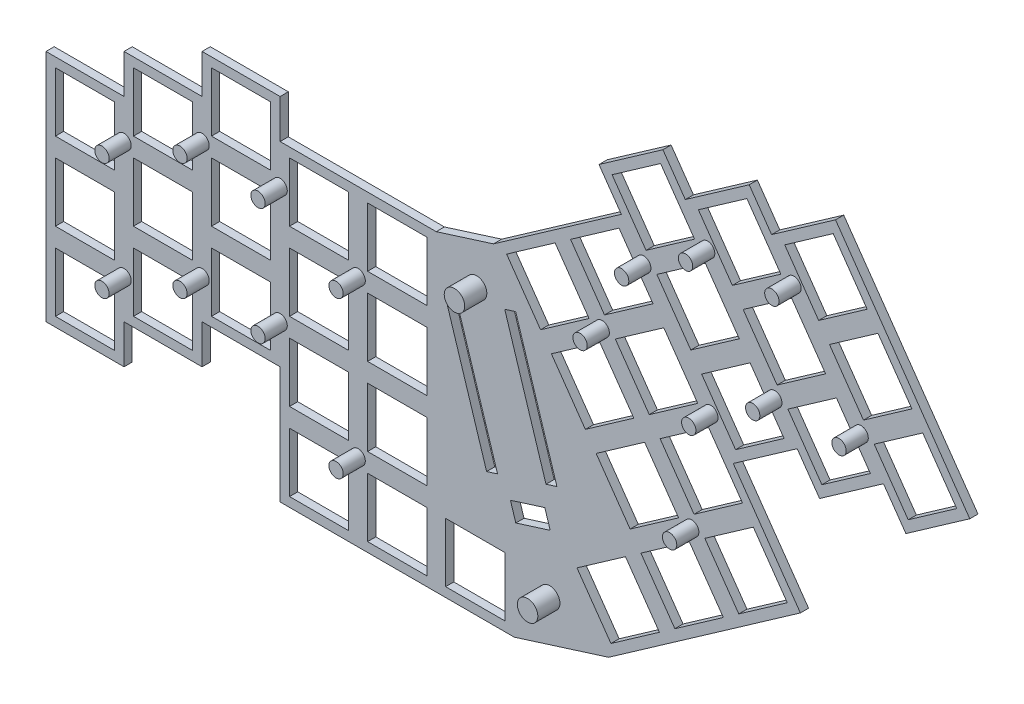
from build123d import *

# Parameters (mm, degrees)
SKETCH8_W               = 14.45
SKETCH8_H               = 14.45
SKETCH8_W_2             = 19.05
SKETCH8_H_2             = 19.05
BOSS_EXTRUDE3_DEPTH     = 2
BOSS_EXTRUDE5_DEPTH     = 2
CUT_EXTRUDE1_DEPTH      = 236.163517616
CUT_EXTRUDE1_DEPTH_BACK = 236.163517616
SKETCH17_R              = 1.75
SKETCH17_R_2            = 2.5
BOSS_EXTRUDE6_DEPTH     = 5.4


with BuildPart() as part:
    # Sketch8 → Boss-Extrude3 (new body)
    # profile 1 of 18: a face of its own
    with BuildSketch(Plane.XY):
        Polygon((19.05, 0), (0, 0), (0, -19.05), (19.05, -19.05), (19.05, -9.525), align=None)
        with Locations((9.525, -9.525)):
            Rectangle(SKETCH8_W, SKETCH8_H, mode=Mode.SUBTRACT)
    # profile 2 of 18: a face of its own
    with BuildSketch(Plane.XY):
        Polygon((19.05, 9.525), (19.05, 0), (19.05, -9.525), (38.1, -9.525), (38.1, 0), (38.1, 9.525), align=None)
        with Locations((28.575, 0)):
            Rectangle(SKETCH8_W, SKETCH8_H, mode=Mode.SUBTRACT)
    # profile 3 of 18: a face of its own
    with BuildSketch(Plane.XY):
        Polygon((19.05, -19.05), (0, -19.05), (0, -38.1), (19.05, -38.1), (19.05, -28.575), align=None)
        with Locations((9.525, -28.575)):
            Rectangle(SKETCH8_W, SKETCH8_H, mode=Mode.SUBTRACT)
    # profile 4 of 18: a face of its own
    with BuildSketch(Plane.XY):
        Polygon((38.1, -9.525), (19.05, -9.525), (19.05, -19.05), (19.05, -28.575), (38.1, -28.575), (38.1, -19.05), align=None)
        with Locations((28.575, -19.05)):
            Rectangle(SKETCH8_W, SKETCH8_H, mode=Mode.SUBTRACT)
    # profile 5 of 18: a face of its own
    with BuildSketch(Plane.XY):
        Polygon((19.05, -38.1), (0, -38.1), (0, -57.15), (19.05, -57.15), (19.05, -47.625), align=None)
        with Locations((9.525, -47.625)):
            Rectangle(SKETCH8_W, SKETCH8_H, mode=Mode.SUBTRACT)
    # profile 6 of 18: a face of its own
    with BuildSketch(Plane.XY):
        Polygon((38.1, 0), (38.1, -9.525), (38.1, -19.05), (57.15, -19.05), (57.15, -9.525), (57.15, 0), align=None)
        with Locations((47.625, -9.525)):
            Rectangle(SKETCH8_W, SKETCH8_H, mode=Mode.SUBTRACT)
    # profile 7 of 18: a face of its own
    with BuildSketch(Plane.XY):
        Polygon((38.1, 19.05), (38.1, 9.525), (38.1, 0), (57.15, 0), (57.15, 9.525), (57.15, 19.05), align=None)
        with Locations((47.625, 9.525)):
            Rectangle(SKETCH8_W, SKETCH8_H, mode=Mode.SUBTRACT)
    # profile 8 of 18: a face of its own
    with BuildSketch(Plane.XY):
        Polygon((38.1, -28.575), (19.05, -28.575), (19.05, -38.1), (19.05, -47.625), (38.1, -47.625), (38.1, -38.1), align=None)
        with Locations((28.575, -38.1)):
            Rectangle(SKETCH8_W, SKETCH8_H, mode=Mode.SUBTRACT)
    # profile 9 of 18: a face of its own
    with BuildSketch(Plane.XY):
        Polygon((57.15, -19.05), (38.1, -19.05), (38.1, -28.575), (38.1, -38.1), (57.15, -38.1), (57.15, -28.575), align=None)
        with Locations((47.625, -28.575)):
            Rectangle(SKETCH8_W, SKETCH8_H, mode=Mode.SUBTRACT)
    # profile 10 of 18: a face of its own
    with BuildSketch(Plane.XY):
        Polygon((57.15, 9.525), (57.15, 0), (57.15, -9.525), (76.2, -9.525), (76.2, 9.525), align=None)
        with Locations((66.675, 0)):
            Rectangle(SKETCH8_W, SKETCH8_H, mode=Mode.SUBTRACT)
    # profile 11 of 18: a face of its own
    with BuildSketch(Plane.XY):
        Polygon((57.15, -9.525), (57.15, -19.05), (57.15, -28.575), (76.2, -28.575), (76.2, -9.525), align=None)
        with Locations((66.675, -19.05)):
            Rectangle(SKETCH8_W, SKETCH8_H, mode=Mode.SUBTRACT)
    # profile 12 of 18: a face of its own
    with BuildSketch(Plane.XY):
        Polygon((76.2, -28.575), (57.15, -28.575), (57.15, -38.1), (57.15, -47.625), (76.2, -47.625), align=None)
        with Locations((66.675, -38.1)):
            Rectangle(SKETCH8_W, SKETCH8_H, mode=Mode.SUBTRACT)
    # profile 13 of 18: a face of its own
    with BuildSketch(Plane.XY):
        with Locations((85.725, 0)):
            Rectangle(SKETCH8_W_2, SKETCH8_H_2)
        with Locations((85.725, 0)):
            Rectangle(SKETCH8_W, SKETCH8_H, mode=Mode.SUBTRACT)
    # profile 14 of 18: a face of its own
    with BuildSketch(Plane.XY):
        with Locations((85.725, -19.05)):
            Rectangle(SKETCH8_W_2, SKETCH8_H_2)
        with Locations((85.725, -19.05)):
            Rectangle(SKETCH8_W, SKETCH8_H, mode=Mode.SUBTRACT)
    # profile 15 of 18: a face of its own
    with BuildSketch(Plane.XY):
        with Locations((85.725, -38.1)):
            Rectangle(SKETCH8_W_2, SKETCH8_H_2)
        with Locations((85.725, -38.1)):
            Rectangle(SKETCH8_W, SKETCH8_H, mode=Mode.SUBTRACT)
    # profile 16 of 18: a face of its own
    with BuildSketch(Plane.XY):
        with Locations((66.675, -57.15)):
            Rectangle(SKETCH8_W_2, SKETCH8_H_2)
        with Locations((66.675, -57.15)):
            Rectangle(SKETCH8_W, SKETCH8_H, mode=Mode.SUBTRACT)
    # profile 17 of 18: a face of its own
    with BuildSketch(Plane.XY):
        with Locations((85.725, -57.15)):
            Rectangle(SKETCH8_W_2, SKETCH8_H_2)
        with Locations((85.725, -57.15)):
            Rectangle(SKETCH8_W, SKETCH8_H, mode=Mode.SUBTRACT)
    # profile 18 of 18: a face of its own
    with BuildSketch(Plane.XY):
        with Locations((104.775, -57.15)):
            Rectangle(SKETCH8_W_2, SKETCH8_H_2)
        with Locations((104.775, -57.15)):
            Rectangle(SKETCH8_W, SKETCH8_H, mode=Mode.SUBTRACT)
    extrude(amount=BOSS_EXTRUDE3_DEPTH)

    # Sketch9 → Boss-Extrude5 (add)
    with BuildSketch(Plane.XY):
        Polygon((114.3, -47.625), (114.3, -66.675), (125.819418193, -63.042941395), (102.24357919, 11.730067049), (95.25, 9.525), (95.25, -47.625), align=None)
    extrude(amount=BOSS_EXTRUDE5_DEPTH)

    # Mirror4: part across plane


with BuildPart() as part_1:
    add(part.part)
    add(part.part.mirror(Plane(origin=(96.362353078, 30.382933219, 0), x_dir=(0, 0, 1), z_dir=(0.9537169507482277, 0.3007057995042709, 0))))

    # Sketch11 → Cut-Extrude1 (cut, two sides: drawn at the far end of the back side and taken through both)
    with BuildSketch(Plane.XY.offset(2).offset(-CUT_EXTRUDE1_DEPTH_BACK)):
        Polygon((121.764653081, -35.550627536), (123.072723309, -39.699296272), (114.680014142, -42.345507307), (113.371943914, -38.196838572), align=None)
        Polygon((111.975587939, 1.482237731), (114.645995401, 2.32421397), (124.719639684, -29.62530388), (122.049232222, -30.467280119), align=None)
        Polygon((110.223142033, -34.196032033), (107.552734571, -35.038008271), (97.479090287, -3.088490421), (100.149497749, -2.246514183), align=None)
    extrude(amount=CUT_EXTRUDE1_DEPTH + CUT_EXTRUDE1_DEPTH_BACK, mode=Mode.SUBTRACT)

    # Sketch17 → Boss-Extrude6 (add)
    with BuildSketch(Plane.XY.offset(2)):
        with Locations((38.1, -28.575)):
            Circle(SKETCH17_R)
        with Locations((19.05, -9.525)):
            Circle(SKETCH17_R)
        with Locations((19.05, -38.1)):
            Circle(SKETCH17_R)
        with Locations((38.1, 0)):
            Circle(SKETCH17_R)
        with Locations((76.2, -9.525)):
            Circle(SKETCH17_R)
        with Locations((76.2, -47.625)):
            Circle(SKETCH17_R)
        with Locations((57.15, -28.575)):
            Circle(SKETCH17_R)
        with Locations((57.15, 0)):
            Circle(SKETCH17_R)
        with Locations((122.955195453, -53.958787439)):
            Circle(SKETCH17_R_2)
        with Locations((105.107801931, 2.645913093)):
            Circle(SKETCH17_R_2)
        with Locations((145.910166824, 27.9859731)):
            Circle(SKETCH17_R)
        with Locations((162.300113493, 4.578703435)):
            Circle(SKETCH17_R)
        with Locations((157.621898162, -21.952774121)):
            Circle(SKETCH17_R)
        with Locations((135.768635937, 9.256918766)):
            Circle(SKETCH17_R)
        with Locations((161.515013268, 38.912604213)):
            Circle(SKETCH17_R)
        with Locations((198.973121937, 18.629542438)):
            Circle(SKETCH17_R)
        with Locations((182.583175268, 42.036812104)):
            Circle(SKETCH17_R)
        with Locations((177.904959937, 15.505334547)):
            Circle(SKETCH17_R)
    extrude(amount=BOSS_EXTRUDE6_DEPTH)


solid = part_1.part
